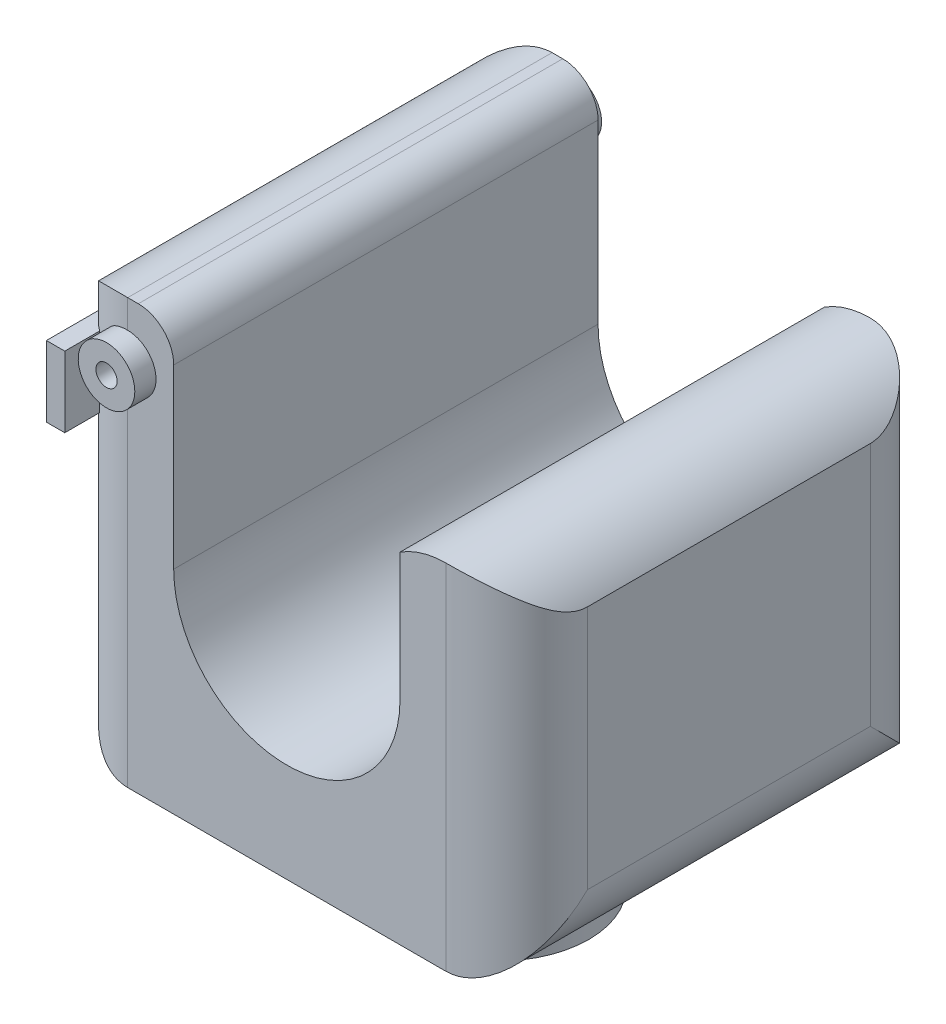
from build123d import *

# Parameters (mm, degrees)
SALIENTE_EXTRUIR1_DEPTH = 30
CROQUIS2_R              = 4
CROQUIS2_R_2            = 1.5
CROQUIS2_W              = 2.6
CROQUIS2_H              = 10
SALIENTE_EXTRUIR2_DEPTH = 3
REDONDEO1_R             = 10
REDONDEO2_R             = 5
CORTAR_EXTRUIR1_DEPTH   = 50


with BuildPart() as part:
    # Croquis1 → Saliente-Extruir1 (new, symmetric)
    with BuildSketch(Plane.XY):
        with BuildLine():
            Line((-32.5, 30), (-16, 30))
            Line((-16, 30), (-16, 0))
            ThreePointArc((-16, 0), (0, -16), (16, 0))
            Line((16, 0), (16, 30))
            Line((16, 30), (32.5, 30))
            Line((32.5, 30), (32.5, -30))
            Line((32.5, -30), (-32.5, -30))
            Line((-32.5, -30), (-32.5, 30))
        make_face()
    extrude(amount=SALIENTE_EXTRUIR1_DEPTH, both=True)

    # Croquis2 → Saliente-Extruir2 (add)
    # profile 1 of 2: a face of its own
    with BuildSketch(Plane.XY.offset(30)):
        with Locations((-22.5, 22)):
            Circle(CROQUIS2_R)
        with Locations((-22.5, 22)):
            Circle(CROQUIS2_R_2, mode=Mode.SUBTRACT)
    # profile 2 of 2: a face of its own
    with BuildSketch(Plane.XY.offset(30)):
        with Locations((-29.7, 17)):
            Rectangle(CROQUIS2_W, CROQUIS2_H)
    saliente_extruir2 = extrude(amount=SALIENTE_EXTRUIR2_DEPTH)

    # Croquis4 → Revolución1 (revolve)
    with BuildSketch(Plane.XY, mode=Mode.PRIVATE) as revoluci_n1_sk:
        Polygon((0, -30), (14, -30), (14, -38), (7.3, -38), (7.3, -42), (12.7, -42), (12.7, -46), (0, -46), align=None)
    revolve(revoluci_n1_sk.sketch.rotate(Axis((0, -19.505365955, 0), (0, -1, 0)), 90), axis=Axis((0, -19.505365955, 0), (0, -1, 0)))

    # Simetría2: Saliente-Extruir2 across plane
    add(saliente_extruir2.mirror(Plane.XY))

    # Redondeo1
    # the kernel refuses this fillet: 10 mm, written as the material it takes off along each edge
    with BuildSketch(Plane(origin=(32.5, 55, -30), x_dir=(-1, 0, 0), z_dir=(0, -1, 0)), Plane(origin=(-32.5, 30, -55), x_dir=(1, 0, 0), z_dir=(0, 0, 1)), Plane(origin=(32.5, -30, -55), x_dir=(-1, 0, 0), z_dir=(0, 0, 1)), Plane(origin=(-32.5, -30, -55), x_dir=(0, 1, 0), z_dir=(0, 0, 1))) as redondeo1_piece_1:
        with BuildLine():
            CenterArc((REDONDEO1_R, -REDONDEO1_R), REDONDEO1_R, 90, 90)
            Line((0, -REDONDEO1_R), (0, 0))
            Line((0, 0), (REDONDEO1_R, 0))
        make_face()
    extrude(amount=110, mode=Mode.SUBTRACT)
    with BuildSketch(Plane(origin=(-32.5, -55, -30), x_dir=(0, 0, 1), z_dir=(0, 1, 0))) as redondeo1_piece_2_section:
        with BuildLine():
            CenterArc((REDONDEO1_R, REDONDEO1_R), REDONDEO1_R, 180, 90)
            Line((0, REDONDEO1_R), (0, 0))
            Line((0, 0), (REDONDEO1_R, 0))
        make_face()
    redondeo1_piece_2 = extrude(amount=110, mode=Mode.PRIVATE)
    redondeo1_piece_2 = split(redondeo1_piece_2, bisect_by=Plane(origin=(-31, -9, -26.666087893), z_dir=(-1, 0, 0)), keep=Keep.TOP, mode=Mode.PRIVATE)
    add(redondeo1_piece_2, mode=Mode.SUBTRACT)
    with BuildSketch(Plane(origin=(-32.5, -55, -30), x_dir=(0, 0, 1), z_dir=(0, 1, 0))) as redondeo1_piece_3_section:
        with BuildLine():
            CenterArc((REDONDEO1_R, REDONDEO1_R), REDONDEO1_R, 180, 90)
            Line((0, REDONDEO1_R), (0, 0))
            Line((0, 0), (REDONDEO1_R, 0))
        make_face()
    redondeo1_piece_3 = extrude(amount=110, mode=Mode.PRIVATE)
    redondeo1_piece_3 = split(redondeo1_piece_3, bisect_by=Plane(origin=(-29.890039843, 12, -28.324282077), z_dir=(0, -1, 0)), keep=Keep.TOP, mode=Mode.PRIVATE)
    add(redondeo1_piece_3, mode=Mode.SUBTRACT)
    with BuildSketch(Plane(origin=(-32.5, -55, -30), x_dir=(0, 0, 1), z_dir=(0, 1, 0))) as redondeo1_piece_4_section:
        with BuildLine():
            CenterArc((REDONDEO1_R, REDONDEO1_R), REDONDEO1_R, 180, 90)
            Line((0, REDONDEO1_R), (0, 0))
            Line((0, 0), (REDONDEO1_R, 0))
        make_face()
    redondeo1_piece_4 = extrude(amount=110, mode=Mode.PRIVATE)
    redondeo1_piece_4 = split(redondeo1_piece_4, bisect_by=Plane(origin=(-28.4, 16.722523597, -29.405754559), z_dir=(1, 0, 0)), keep=Keep.TOP, mode=Mode.PRIVATE)
    redondeo1_piece_4 = redondeo1_piece_4 - Plane(origin=(-22.5, 22, -29.405754559), x_dir=(1, 0, 0), z_dir=(0, 0, 1)) * Cylinder(4, 260, mode=Mode.PRIVATE)
    add(redondeo1_piece_4, mode=Mode.SUBTRACT)
    with BuildSketch(Plane(origin=(-32.5, -55, -30), x_dir=(0, 0, 1), z_dir=(0, 1, 0))) as redondeo1_piece_5_section:
        with BuildLine():
            CenterArc((REDONDEO1_R, REDONDEO1_R), REDONDEO1_R, 180, 90)
            Line((0, REDONDEO1_R), (0, 0))
            Line((0, 0), (REDONDEO1_R, 0))
        make_face()
    redondeo1_piece_5 = extrude(amount=110, mode=Mode.PRIVATE)
    redondeo1_piece_5 = split(redondeo1_piece_5, bisect_by=Plane(origin=(-29.890039843, 22, -28.324282077), z_dir=(0, 1, 0)), keep=Keep.TOP, mode=Mode.PRIVATE)
    redondeo1_piece_5 = split(redondeo1_piece_5, bisect_by=Plane(origin=(-28.4, 26, -28.324282077), z_dir=(-1, 0, 0)), keep=Keep.TOP, mode=Mode.PRIVATE)
    add(redondeo1_piece_5, mode=Mode.SUBTRACT)
    with BuildSketch(Plane(origin=(32.5, 55, 30), x_dir=(-1, 0, 0), z_dir=(0, -1, 0)), Plane(origin=(32.5, 30, 55), x_dir=(0, -1, 0), z_dir=(0, 0, -1))) as redondeo1_piece_6:
        with BuildLine():
            CenterArc((REDONDEO1_R, REDONDEO1_R), REDONDEO1_R, 180, 90)
            Line((0, REDONDEO1_R), (0, 0))
            Line((0, 0), (REDONDEO1_R, 0))
        make_face()
    extrude(amount=110, mode=Mode.SUBTRACT)
    with BuildSketch(Plane(origin=(-32.5, -55, 30), x_dir=(0, 0, -1), z_dir=(0, 1, 0))) as redondeo1_piece_7_section:
        with BuildLine():
            CenterArc((REDONDEO1_R, -REDONDEO1_R), REDONDEO1_R, 90, 90)
            Line((0, -REDONDEO1_R), (0, 0))
            Line((0, 0), (REDONDEO1_R, 0))
        make_face()
    redondeo1_piece_7 = extrude(amount=110, mode=Mode.PRIVATE)
    redondeo1_piece_7 = split(redondeo1_piece_7, bisect_by=Plane(origin=(-31, -9, 26.666087893), z_dir=(-1, 0, 0)), keep=Keep.TOP, mode=Mode.PRIVATE)
    add(redondeo1_piece_7, mode=Mode.SUBTRACT)
    with BuildSketch(Plane(origin=(-32.5, -55, 30), x_dir=(0, 0, -1), z_dir=(0, 1, 0))) as redondeo1_piece_8_section:
        with BuildLine():
            CenterArc((REDONDEO1_R, -REDONDEO1_R), REDONDEO1_R, 90, 90)
            Line((0, -REDONDEO1_R), (0, 0))
            Line((0, 0), (REDONDEO1_R, 0))
        make_face()
    redondeo1_piece_8 = extrude(amount=110, mode=Mode.PRIVATE)
    redondeo1_piece_8 = split(redondeo1_piece_8, bisect_by=Plane(origin=(-29.890039843, 12, 28.324282077), z_dir=(0, -1, 0)), keep=Keep.TOP, mode=Mode.PRIVATE)
    add(redondeo1_piece_8, mode=Mode.SUBTRACT)
    with BuildSketch(Plane(origin=(-32.5, -55, 30), x_dir=(0, 0, -1), z_dir=(0, 1, 0))) as redondeo1_piece_9_section:
        with BuildLine():
            CenterArc((REDONDEO1_R, -REDONDEO1_R), REDONDEO1_R, 90, 90)
            Line((0, -REDONDEO1_R), (0, 0))
            Line((0, 0), (REDONDEO1_R, 0))
        make_face()
    redondeo1_piece_9 = extrude(amount=110, mode=Mode.PRIVATE)
    redondeo1_piece_9 = split(redondeo1_piece_9, bisect_by=Plane(origin=(-28.4, 16.722523597, 29.405754559), z_dir=(1, 0, 0)), keep=Keep.TOP, mode=Mode.PRIVATE)
    redondeo1_piece_9 = redondeo1_piece_9 - Plane(origin=(-22.5, 22, 29.405754559), x_dir=(1, 0, 0), z_dir=(0, 0, -1)) * Cylinder(4, 260, mode=Mode.PRIVATE)
    add(redondeo1_piece_9, mode=Mode.SUBTRACT)
    with BuildSketch(Plane(origin=(-32.5, -55, 30), x_dir=(0, 0, -1), z_dir=(0, 1, 0))) as redondeo1_piece_10_section:
        with BuildLine():
            CenterArc((REDONDEO1_R, -REDONDEO1_R), REDONDEO1_R, 90, 90)
            Line((0, -REDONDEO1_R), (0, 0))
            Line((0, 0), (REDONDEO1_R, 0))
        make_face()
    redondeo1_piece_10 = extrude(amount=110, mode=Mode.PRIVATE)
    redondeo1_piece_10 = split(redondeo1_piece_10, bisect_by=Plane(origin=(-29.890039843, 22, 28.324282077), z_dir=(0, 1, 0)), keep=Keep.TOP, mode=Mode.PRIVATE)
    redondeo1_piece_10 = split(redondeo1_piece_10, bisect_by=Plane(origin=(-28.4, 26, 28.324282077), z_dir=(-1, 0, 0)), keep=Keep.TOP, mode=Mode.PRIVATE)
    add(redondeo1_piece_10, mode=Mode.SUBTRACT)

    # Redondeo2
    redondeo2_edges = [part.edges().sort_by_distance(p)[0] for p in [
        (-16, 30, 0),
        (16, 30, 0),
    ]]
    fillet(redondeo2_edges, radius=REDONDEO2_R)

    # Croquis5 → Cortar-Extruir1 (cut, symmetric)
    with BuildSketch(Plane.XY):
        with BuildLine():
            ThreePointArc((16, 18.087120501), (24.958618735, 19.745432896), (32.5, 14.633249581))
            Line((32.5, 14.633249581), (32.5, 20))
            ThreePointArc((32.5, 20), (29.571067812, 27.071067812), (22.5, 30))
            Line((22.5, 30), (21, 30))
            ThreePointArc((21, 30), (17.464466094, 28.535533906), (16, 25))
            Line((16, 25), (16, 18.087120501))
        make_face()
    extrude(amount=CORTAR_EXTRUIR1_DEPTH, both=True, mode=Mode.SUBTRACT)


solid = part.part
